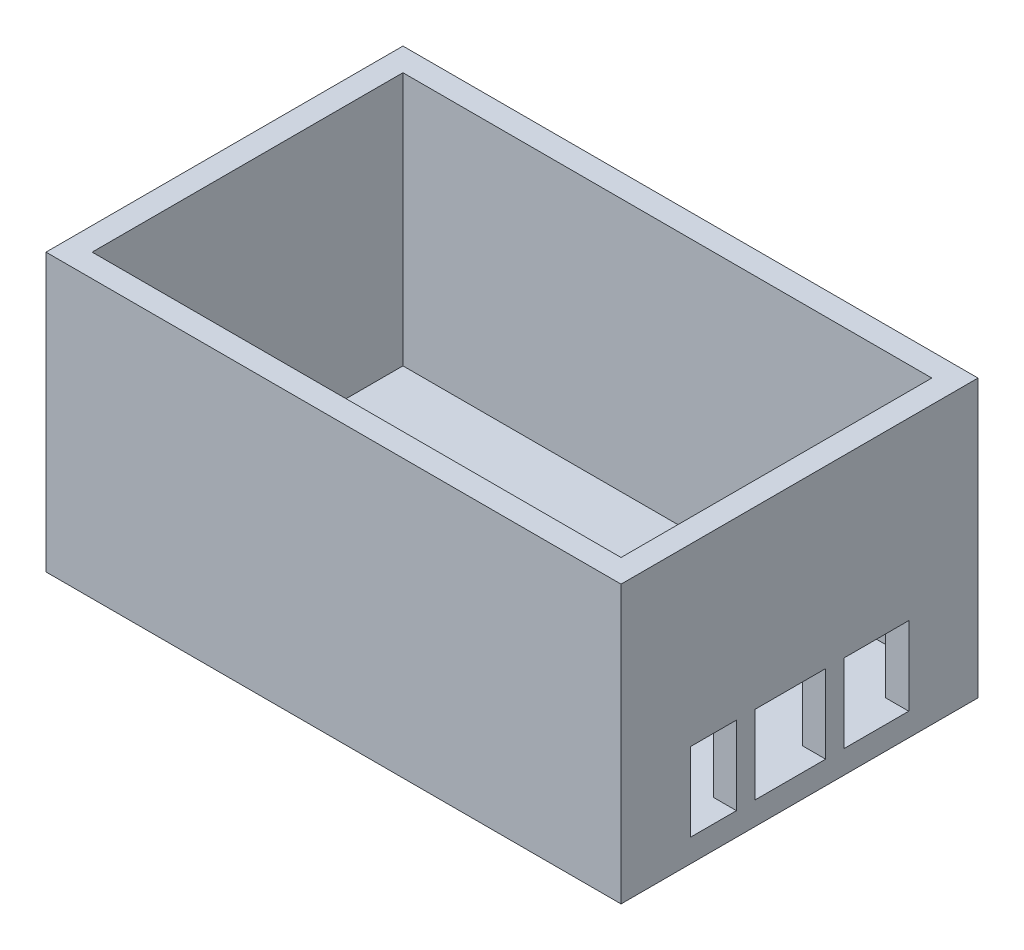
from build123d import *

# Parameters (mm, degrees)
SKETCH1_W           = 158.2
SKETCH1_H           = 98.2
BOSS_EXTRUDE1_DEPTH = 6.35
SKETCH2_W           = 158.2
SKETCH2_H           = 69.85
BOSS_EXTRUDE2_DEPTH = 6.35
SKETCH3_W           = 85.5
SKETCH3_H           = 69.85
BOSS_EXTRUDE3_DEPTH = 6.35
SKETCH4_W           = 158.2
SKETCH4_H           = 69.85
BOSS_EXTRUDE4_DEPTH = 6.35
SKETCH5_W           = 85.5
SKETCH5_H           = 48.26
BOSS_EXTRUDE5_DEPTH = 6.35
SKETCH6_W           = 5.08
SKETCH6_H           = 21.59
SKETCH6_W_2         = 12.7
BOSS_EXTRUDE6_DEPTH = 6.35


with BuildPart() as part:
    # Sketch1 → Boss-Extrude1 (new body)
    with BuildSketch(Plane(origin=(0, 0, 0), x_dir=(1, 0, 0), z_dir=(0, 1, 0))):
        Rectangle(SKETCH1_W, SKETCH1_H)
    extrude(amount=BOSS_EXTRUDE1_DEPTH)

    # Sketch2 → Boss-Extrude2 (add)
    with BuildSketch(Plane.XY.offset(49.1)):
        with Locations((0, 41.275)):
            Rectangle(SKETCH2_W, SKETCH2_H)
    extrude(amount=-BOSS_EXTRUDE2_DEPTH)

    # Sketch3 → Boss-Extrude3 (add)
    with BuildSketch(Plane.ZY.offset(79.1)):
        with Locations((0, 41.275)):
            Rectangle(SKETCH3_W, SKETCH3_H)
    extrude(amount=-BOSS_EXTRUDE3_DEPTH)

    # Sketch4 → Boss-Extrude4 (add)
    with BuildSketch(Plane(origin=(0, 0, -49.1), x_dir=(-1, 0, 0), z_dir=(0, 0, -1))):
        with Locations((0, 41.275)):
            Rectangle(SKETCH4_W, SKETCH4_H)
    extrude(amount=-BOSS_EXTRUDE4_DEPTH)

    # Sketch5 → Boss-Extrude5 (add)
    with BuildSketch(Plane(origin=(79.1, 0, 0), x_dir=(0, 0, -1), z_dir=(1, 0, 0))):
        with Locations((0, 52.07)):
            Rectangle(SKETCH5_W, SKETCH5_H)
    extrude(amount=-BOSS_EXTRUDE5_DEPTH)

    # Sketch6 → Boss-Extrude6 (add)
    with BuildSketch(Plane(origin=(79.1, 0, 0), x_dir=(0, 0, -1), z_dir=(1, 0, 0))):
        with Locations((-14.81, 17.145)):
            Rectangle(SKETCH6_W, SKETCH6_H)
        with Locations((9.73, 17.145)):
            Rectangle(SKETCH6_W, SKETCH6_H)
        with Locations((-36.4, 17.145)):
            Rectangle(SKETCH6_W_2, SKETCH6_H)
        with Locations((36.4, 17.145)):
            Rectangle(SKETCH6_W_2, SKETCH6_H)
    extrude(amount=-BOSS_EXTRUDE6_DEPTH)


solid = part.part
